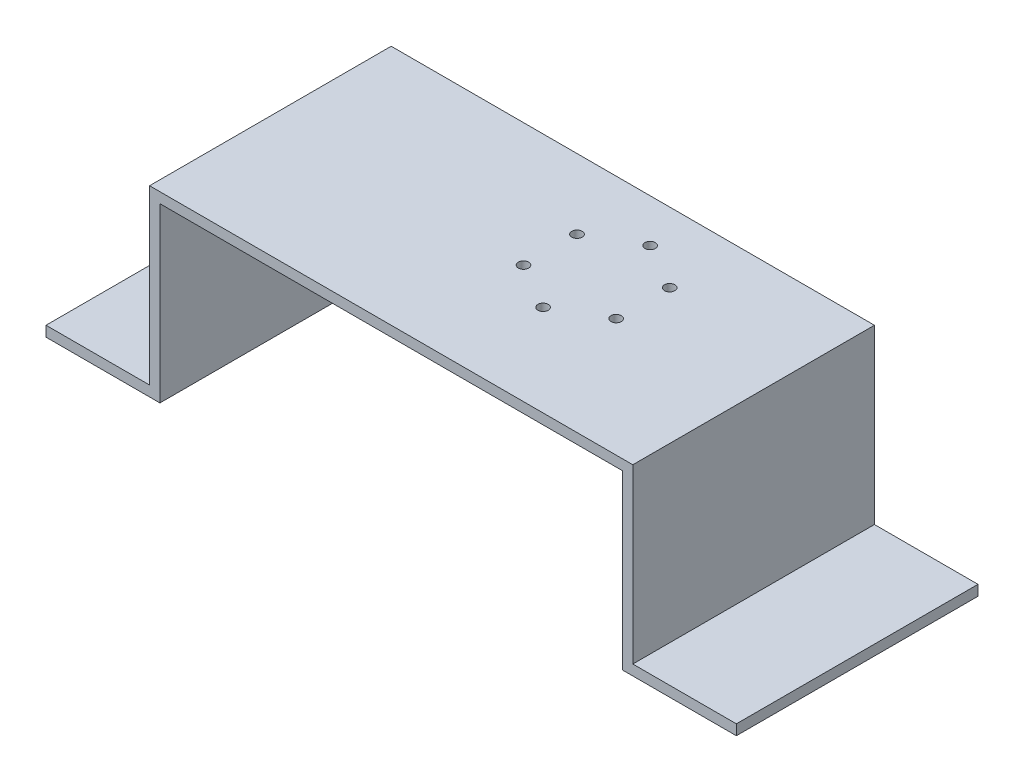
from build123d import *

# Parameters (mm, degrees)
EXTRUDE_1_DEPTH     = 70
SKETCH_2_R          = 1.5
CUT_EXTRUDE_1_DEPTH = 10


with BuildPart() as part:
    # 草图1 → 凸台-拉伸1 (new body)
    with BuildSketch(Plane.XY):
        Polygon((0, 0), (30, 0), (30, 50), (170, 50), (170, 0), (200, 0), (200, -3), (167, -3), (167, 47), (33, 47), (33, -3), (0, -3), align=None)
    extrude(amount=EXTRUDE_1_DEPTH)

    # 草图2 → 切除-拉伸1 (cut)
    with BuildSketch(Plane(origin=(0, 50, 0), x_dir=(1, 0, 0), z_dir=(0, 1, 0))):
        with Locations((117.50208337, -43.5)):
            Circle(SKETCH_2_R)
        with Locations((130.925477128, -35.75)):
            Circle(SKETCH_2_R)
        with Locations((130.925477128, -20.25)):
            Circle(SKETCH_2_R)
        with Locations((117.50208337, -12.5)):
            Circle(SKETCH_2_R)
        with Locations((104.078689611, -35.75)):
            Circle(SKETCH_2_R)
        with Locations((104.078689611, -20.25)):
            Circle(SKETCH_2_R)
    extrude(amount=-CUT_EXTRUDE_1_DEPTH, mode=Mode.SUBTRACT)


solid = part.part
